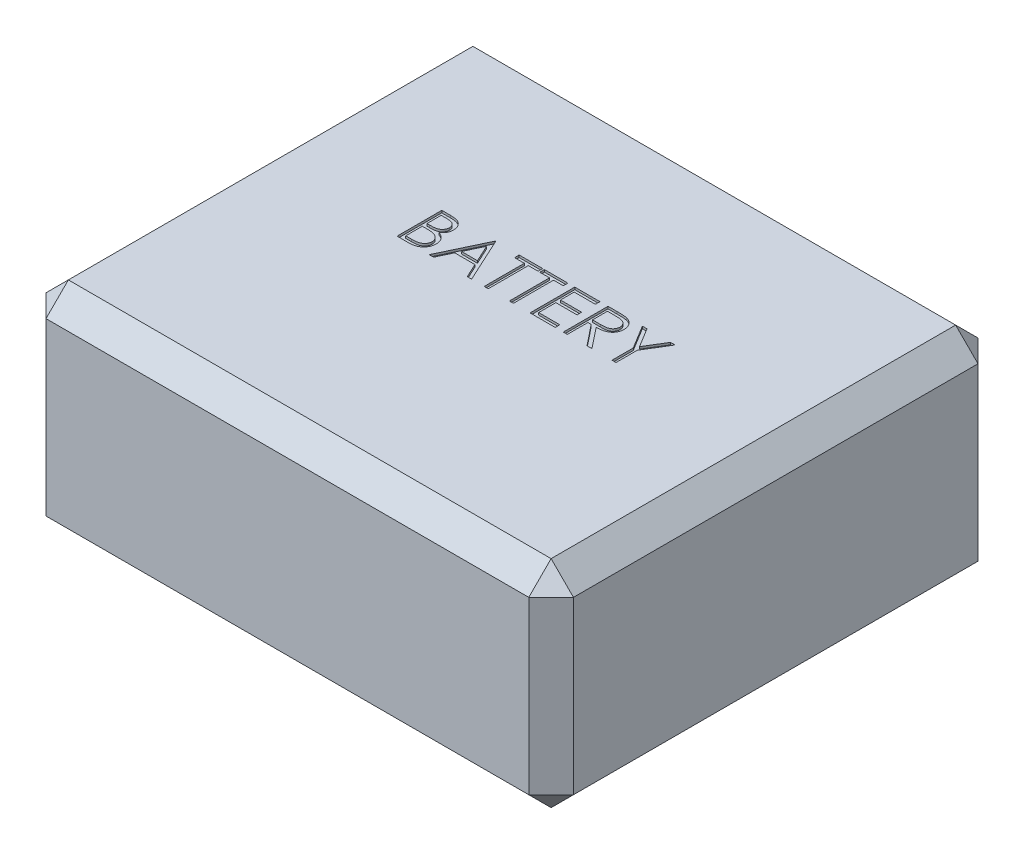
from build123d import *

# Parameters (mm, degrees)
SKETCH1_W           = 236
SKETCH1_H           = 201
BOSS_EXTRUDE1_DEPTH = 96.5
CUT_EXTRUDE1_DEPTH  = 1
CHAMFER1_SIZE       = 10


with BuildPart() as part:
    # Sketch1 → Boss-Extrude1 (new body)
    with BuildSketch(Plane(origin=(0, 0, 0), x_dir=(1, 0, 0), z_dir=(0, 1, 0))):
        with Locations((118, 100.5)):
            Rectangle(SKETCH1_W, SKETCH1_H)
    extrude(amount=BOSS_EXTRUDE1_DEPTH)

    # Sketch2 → Cut-Extrude1 (cut)
    # profile 1 of 7: a face of its own
    with BuildSketch(Plane(origin=(0, 96.5, 0), x_dir=(1, 0, 0), z_dir=(0, 1, 0))):
        with BuildLine():
            Line((66.58974359, 120.5), (70.491987179, 120.5))
            add(Edge.make_bspline(
                [(70.491987179, 120.5), (70.683007055, 120.498995712), (71.053251114, 120.497049152), (71.591647924, 120.466859831), (72.095926842, 120.425696003), (72.566234113, 120.360381188), (73.002352412, 120.281571033), (73.405596054, 120.186132084), (73.774682752, 120.071694292), (74.21532696, 119.889715542), (74.717730737, 119.619297437), (75.261721552, 119.219705636), (75.726888634, 118.730948704), (76.127953304, 118.179619244), (76.446816845, 117.57312912), (76.677498544, 116.925933755), (76.823543546, 116.246380945), (76.83856317, 115.779848499), (76.846153846, 115.544070513)],
                knots=[0, 0, 0, 0, 1.001505555, 1.941167018, 2.826882275, 3.653841531, 4.429895133, 5.150066043, 5.825578002, 6.45369114, 7.647487171, 8.808567382, 9.977351308, 11.170798116, 12.373658725, 13.556498008, 14.765093433, 16, 16, 16, 16], degree=3))
            add(Edge.make_bspline(
                [(76.846153846, 115.544070513), (76.839906884, 115.323198766), (76.827631013, 114.889164955), (76.710243817, 114.254341473), (76.526468569, 113.650048794), (76.271010002, 113.078492306), (75.938998595, 112.552585945), (75.545522489, 112.068087282), (75.070797903, 111.645509813), (74.715122246, 111.409264656), (74.534455128, 111.289262821)],
                knots=[0, 0, 0, 0, 1.044552857, 2.05264487, 3.044412934, 4.028983338, 5.005914585, 5.980388656, 6.974128949, 8, 8, 8, 8], degree=3))
            add(Edge.make_bspline(
                [(74.534455128, 111.289262821), (74.761657572, 111.202034255), (75.196352128, 111.035144401), (75.794557913, 110.740084607), (76.309957028, 110.419158262), (76.746512148, 110.068690547), (77.119870176, 109.690925914), (77.445886985, 109.280325261), (77.724066266, 108.831532359), (77.962425829, 108.349226443), (78.14841872, 107.838332338), (78.287709602, 107.303642189), (78.367523598, 106.747073302), (78.378881548, 106.368299705), (78.384615385, 106.177083333)],
                knots=[0, 0, 0, 0, 1.27268992, 2.434971085, 3.483601985, 4.442670788, 5.356604649, 6.2567628, 7.179492994, 8.113709626, 9.066344395, 10.018646069, 10.999752585, 12, 12, 12, 12], degree=3))
            add(Edge.make_bspline(
                [(78.384615385, 106.177083333), (78.379033407, 105.981844064), (78.368050711, 105.597705332), (78.2870223, 105.033390277), (78.149827403, 104.494104868), (77.960849424, 103.976360967), (77.714207626, 103.481160199), (77.41404783, 103.007941547), (77.056153181, 102.561459658), (76.65579393, 102.13675324), (76.202867384, 101.75488017), (75.714205927, 101.414790417), (75.183655528, 101.135098634), (74.619929848, 100.90014994), (74.016705184, 100.720680234), (73.376690285, 100.595122669), (72.700437132, 100.510522457), (72.236381411, 100.503567001), (71.998397436, 100.5)],
                knots=[0, 0, 0, 0, 0.978564426, 1.925352924, 2.850884081, 3.763762016, 4.682927383, 5.618979971, 6.567305752, 7.547517671, 8.540179244, 9.531824382, 10.526200242, 11.540722885, 12.589160233, 13.674978461, 14.80764778, 16, 16, 16, 16], degree=3))
            Line((71.998397436, 100.5), (66.58974359, 100.5))
            Line((66.58974359, 100.5), (66.58974359, 120.5))
        make_face()
        with BuildLine():
            Line((68.384615385, 118.448717949), (68.384615385, 112.038461538))
            Line((68.384615385, 112.038461538), (69.590544872, 112.038461538))
            add(Edge.make_bspline(
                [(69.590544872, 112.038461538), (69.766823702, 112.040746813), (70.107430327, 112.045162428), (70.600686879, 112.057811097), (71.058544125, 112.093228488), (71.480211743, 112.1286357), (71.865025708, 112.186204772), (72.212133488, 112.254731189), (72.526982614, 112.327204933), (72.890065731, 112.450459143), (73.301911151, 112.632617287), (73.74095746, 112.915313494), (74.128011572, 113.252024083), (74.454852645, 113.640543865), (74.722346762, 114.068350641), (74.90813942, 114.528618529), (75.034123901, 115.009876427), (75.045504081, 115.340266443), (75.051282051, 115.508012821)],
                knots=[0, 0, 0, 0, 1.156816544, 2.235205308, 3.236616184, 4.169592532, 5.011045266, 5.787822928, 6.49130361, 7.128639758, 8.301311294, 9.436451833, 10.541879658, 11.654887649, 12.756523258, 13.837046038, 14.901820046, 16, 16, 16, 16], degree=3))
            add(Edge.make_bspline(
                [(75.051282051, 115.508012821), (75.048275307, 115.619017229), (75.042377251, 115.836764498), (74.994072665, 116.154189379), (74.911972239, 116.452725108), (74.806519135, 116.736462881), (74.659155199, 116.996530597), (74.485649695, 117.241920286), (74.276017179, 117.464275249), (74.037403964, 117.672100954), (73.763068976, 117.856355398), (73.45317588, 118.017731188), (73.103532011, 118.147678483), (72.720029982, 118.261485069), (72.296766625, 118.341418176), (71.83862632, 118.408008963), (71.341856497, 118.441910346), (70.998170197, 118.446398134), (70.820512821, 118.448717949)],
                knots=[0, 0, 0, 0, 0.91205012, 1.789085906, 2.630437955, 3.453916878, 4.269457761, 5.079663411, 5.91843418, 6.774407191, 7.675494373, 8.627863946, 9.638891023, 10.736472738, 11.911756761, 13.175263542, 14.539845004, 16, 16, 16, 16], degree=3))
            Line((70.820512821, 118.448717949), (68.384615385, 118.448717949))
        make_face(mode=Mode.SUBTRACT)
        with BuildLine():
            Line((68.384615385, 109.987179487), (68.384615385, 102.551282051))
            Line((68.384615385, 102.551282051), (70.940705128, 102.551282051))
            add(Edge.make_bspline(
                [(70.940705128, 102.551282051), (71.123670419, 102.553474894), (71.476311897, 102.557701308), (71.985461783, 102.571498763), (72.457365233, 102.602883195), (72.889868866, 102.65228805), (73.287642881, 102.705879188), (73.64591547, 102.777943651), (73.967590861, 102.86050914), (74.340586905, 102.988132981), (74.760606953, 103.186398529), (75.213240418, 103.485336966), (75.61567595, 103.841470153), (75.957420288, 104.253646805), (76.237494509, 104.701825816), (76.441239966, 105.176942102), (76.566902005, 105.671145116), (76.582114401, 106.008097759), (76.58974359, 106.177083333)],
                knots=[0, 0, 0, 0, 1.160039823, 2.235823828, 3.228722157, 4.157150951, 4.99529583, 5.772374946, 6.472645482, 7.099169577, 8.269452708, 9.405989375, 10.527446681, 11.663510218, 12.788923519, 13.866172445, 14.929861265, 16, 16, 16, 16], degree=3))
            add(Edge.make_bspline(
                [(76.58974359, 106.177083333), (76.588165851, 106.282759565), (76.585035822, 106.492407461), (76.537832308, 106.800497856), (76.469181623, 107.098931418), (76.380430572, 107.388518506), (76.251176475, 107.664023514), (76.100281932, 107.930895283), (75.923359637, 108.189486594), (75.647678689, 108.516413756), (75.24669592, 108.893082402), (74.676942918, 109.261868129), (74.029101215, 109.559284169), (73.559229827, 109.685566891), (73.31650641, 109.750801282)],
                knots=[0, 0, 0, 0, 0.723448775, 1.435228256, 2.130040452, 2.821711965, 3.505591119, 4.210454504, 4.921174351, 5.648778258, 7.137944449, 8.670945889, 10.280296675, 12, 12, 12, 12], degree=3))
            add(Edge.make_bspline(
                [(73.31650641, 109.750801282), (73.219197291, 109.770544619), (73.008211049, 109.813352246), (72.664167732, 109.858539122), (72.271391339, 109.898796607), (71.828974897, 109.928574651), (71.336358662, 109.9593549), (70.792490556, 109.971325306), (70.199591615, 109.985606793), (69.78820663, 109.986641845), (69.574519231, 109.987179487)],
                knots=[0, 0, 0, 0, 0.634451884, 1.375622551, 2.216452059, 3.157844607, 4.20941857, 5.370758133, 6.634282058, 8, 8, 8, 8], degree=3))
            Line((69.574519231, 109.987179487), (68.384615385, 109.987179487))
        make_face(mode=Mode.SUBTRACT)
    # profile 2 of 7: a face of its own
    with BuildSketch(Plane(origin=(0, 96.5, 0), x_dir=(1, 0, 0), z_dir=(0, 1, 0))):
        Polygon((90.692307692, 120.5), (99.923076923, 100.5), (97.971955128, 100.5), (95.015224359, 106.91025641), (85.948717949, 106.91025641), (82.911858974, 100.5), (80.948717949, 100.5), (90.435897436, 120.5), align=None)
        Polygon((90.544070513, 116.59775641), (86.926282051, 108.961538462), (94.069711538, 108.961538462), align=None, mode=Mode.SUBTRACT)
    # profile 3 of 7: a face of its own
    with BuildSketch(Plane(origin=(0, 96.5, 0), x_dir=(1, 0, 0), z_dir=(0, 1, 0))):
        Polygon((101.205128205, 118.448717949), (101.205128205, 120.5), (111.717948718, 120.5), (111.717948718, 118.448717949), (107.358974359, 118.448717949), (107.358974359, 100.5), (105.564102564, 100.5), (105.564102564, 118.448717949), align=None)
    # profile 4 of 7: a face of its own
    with BuildSketch(Plane(origin=(0, 96.5, 0), x_dir=(1, 0, 0), z_dir=(0, 1, 0))):
        Polygon((112.487179487, 118.448717949), (112.487179487, 120.5), (123, 120.5), (123, 118.448717949), (118.641025641, 118.448717949), (118.641025641, 100.5), (116.846153846, 100.5), (116.846153846, 118.448717949), align=None)
    # profile 5 of 7: a face of its own
    with BuildSketch(Plane(origin=(0, 96.5, 0), x_dir=(1, 0, 0), z_dir=(0, 1, 0))):
        Polygon((126.076923077, 120.5), (137.358974359, 120.5), (137.358974359, 118.448717949), (127.871794872, 118.448717949), (127.871794872, 112.294871795), (137.358974359, 112.294871795), (137.358974359, 110.243589744), (127.871794872, 110.243589744), (127.871794872, 102.551282051), (137.358974359, 102.551282051), (137.358974359, 100.5), (126.076923077, 100.5), align=None)
    # profile 6 of 7: a face of its own
    with BuildSketch(Plane(origin=(0, 96.5, 0), x_dir=(1, 0, 0), z_dir=(0, 1, 0))):
        with BuildLine():
            Line((140.948717949, 120.5), (144.951121795, 120.5))
            add(Edge.make_bspline(
                [(144.951121795, 120.5), (145.218213958, 120.499110937), (145.731060497, 120.497403838), (146.465764899, 120.487885193), (147.133348311, 120.46060316), (147.733461678, 120.43712554), (148.266093992, 120.394314447), (148.732878511, 120.353396464), (149.131665354, 120.299832688), (149.373070218, 120.250087414), (149.482371795, 120.227564103)],
                knots=[0, 0, 0, 0, 1.410062039, 2.707475311, 3.878576406, 4.937260626, 5.877586885, 6.699081471, 7.410979367, 8, 8, 8, 8], degree=3))
            add(Edge.make_bspline(
                [(149.482371795, 120.227564103), (149.628695361, 120.191411158), (149.918221015, 120.119876508), (150.335078536, 119.968678789), (150.732303244, 119.793709506), (151.108245097, 119.588202532), (151.461021047, 119.350632363), (151.794268537, 119.085100235), (152.109499757, 118.793059059), (152.393966215, 118.467145679), (152.662189367, 118.125222766), (152.88841009, 117.755487013), (153.083418546, 117.368849713), (153.238678643, 116.961378754), (153.363695634, 116.537025772), (153.451845573, 116.091946934), (153.504709503, 115.628169933), (153.510091534, 115.311839026), (153.512820513, 115.151442308)],
                knots=[0, 0, 0, 0, 1.027469482, 2.033020251, 3.019912614, 3.986113645, 4.951240523, 5.91722682, 6.890402269, 7.87763091, 8.8651537, 9.85103654, 10.82876324, 11.815024772, 12.821070561, 13.842952187, 14.906261191, 16, 16, 16, 16], degree=3))
            add(Edge.make_bspline(
                [(153.512820513, 115.151442308), (153.504426238, 114.884955996), (153.488046833, 114.364972179), (153.335331955, 113.610338571), (153.085180414, 112.90639963), (152.740475905, 112.254041699), (152.301507473, 111.665980869), (151.773937238, 111.149463981), (151.157470886, 110.717235909), (150.583589081, 110.417505597), (150.076650797, 110.225546119), (149.659317581, 110.090481211), (149.20407771, 109.986127124), (148.715292941, 109.892640657), (148.190929195, 109.822059546), (147.632243256, 109.77036472), (147.038836675, 109.73805587), (146.63118485, 109.733244414), (146.421474359, 109.730769231)],
                knots=[0, 0, 0, 0, 1.260483769, 2.459530307, 3.627416485, 4.787058657, 5.939039949, 7.08810263, 8.267026773, 9.491475466, 10.141966685, 10.831826277, 11.566392101, 12.351337768, 13.187381173, 14.07005841, 15.007169909, 16, 16, 16, 16], degree=3))
            Line((146.421474359, 109.730769231), (153.769230769, 100.5))
            Line((153.769230769, 100.5), (151.549679487, 100.5))
            Line((151.549679487, 100.5), (144.201923077, 109.730769231))
            Line((144.201923077, 109.730769231), (142.743589744, 109.730769231))
            Line((142.743589744, 109.730769231), (142.743589744, 100.5))
            Line((142.743589744, 100.5), (140.948717949, 100.5))
            Line((140.948717949, 100.5), (140.948717949, 120.5))
        make_face()
        with BuildLine():
            Line((142.743589744, 118.448717949), (142.743589744, 111.782051282))
            Line((142.743589744, 111.782051282), (146.405448718, 111.75400641))
            add(Edge.make_bspline(
                [(146.405448718, 111.75400641), (146.576420369, 111.753930772), (146.907812124, 111.753784164), (147.387244494, 111.776605743), (147.833645132, 111.802567561), (148.245306573, 111.842278107), (148.622412718, 111.89345566), (148.964775079, 111.957472713), (149.272952519, 112.032055928), (149.632372738, 112.14749379), (150.033724346, 112.330385323), (150.469904117, 112.596473887), (150.841346047, 112.931154567), (151.155162403, 113.313860031), (151.407330583, 113.734638595), (151.58511375, 114.188446419), (151.697927706, 114.663826979), (151.71123368, 114.990559024), (151.717948718, 115.155448718)],
                knots=[0, 0, 0, 0, 1.146690395, 2.22261258, 3.21895312, 4.145990853, 4.996080663, 5.770904154, 6.481378293, 7.121626537, 8.300444488, 9.431385265, 10.535395872, 11.636531494, 12.74115979, 13.810798291, 14.895190096, 16, 16, 16, 16], degree=3))
            add(Edge.make_bspline(
                [(151.717948718, 115.155448718), (151.711079455, 115.316286282), (151.697467081, 115.635007646), (151.586331261, 116.101612848), (151.398391939, 116.54199542), (151.145122008, 116.954363905), (150.836555408, 117.328682396), (150.474739336, 117.648951842), (150.069566792, 117.913234497), (149.69087423, 118.082116672), (149.352393016, 118.18565869), (149.058509244, 118.258522484), (148.726443657, 118.317062306), (148.354583894, 118.363965511), (147.944517432, 118.404279478), (147.494170854, 118.431432499), (147.00653211, 118.447511722), (146.668549646, 118.448306516), (146.493589744, 118.448717949)],
                knots=[0, 0, 0, 0, 1.101028733, 2.181837193, 3.264309656, 4.369019818, 5.486613113, 6.575447106, 7.666700264, 8.788928104, 9.402425223, 10.0903467, 10.862060571, 11.710948788, 12.657782767, 13.684531032, 14.801375019, 16, 16, 16, 16], degree=3))
            Line((146.493589744, 118.448717949), (142.743589744, 118.448717949))
        make_face(mode=Mode.SUBTRACT)
    # profile 7 of 7: a face of its own
    with BuildSketch(Plane(origin=(0, 96.5, 0), x_dir=(1, 0, 0), z_dir=(0, 1, 0))):
        Polygon((156.333333333, 120.5), (158.388621795, 120.5), (163.637019231, 111.914262821), (168.889423077, 120.5), (170.948717949, 120.5), (164.538461538, 110.007211538), (164.538461538, 100.5), (162.743589744, 100.5), (162.743589744, 110.007211538), align=None)
    extrude(amount=-CUT_EXTRUDE1_DEPTH, mode=Mode.SUBTRACT)

    # Chamfer1
    chamfer1_edges = [part.edges().sort_by_distance(p)[0] for p in [
        (0, 96.5, -100.5),
        (0, 0, -100.5),
        (118, 96.5, -201),
        (0, 48.25, -201),
        (118, 0, -201),
        (236, 96.5, -100.5),
        (236, 48.25, -201),
        (236, 0, -100.5),
        (0, 48.25, 0),
        (118, 96.5, 0),
        (236, 48.25, 0),
        (118, 0, 0),
    ]]
    chamfer(chamfer1_edges, length=CHAMFER1_SIZE)


solid = part.part
